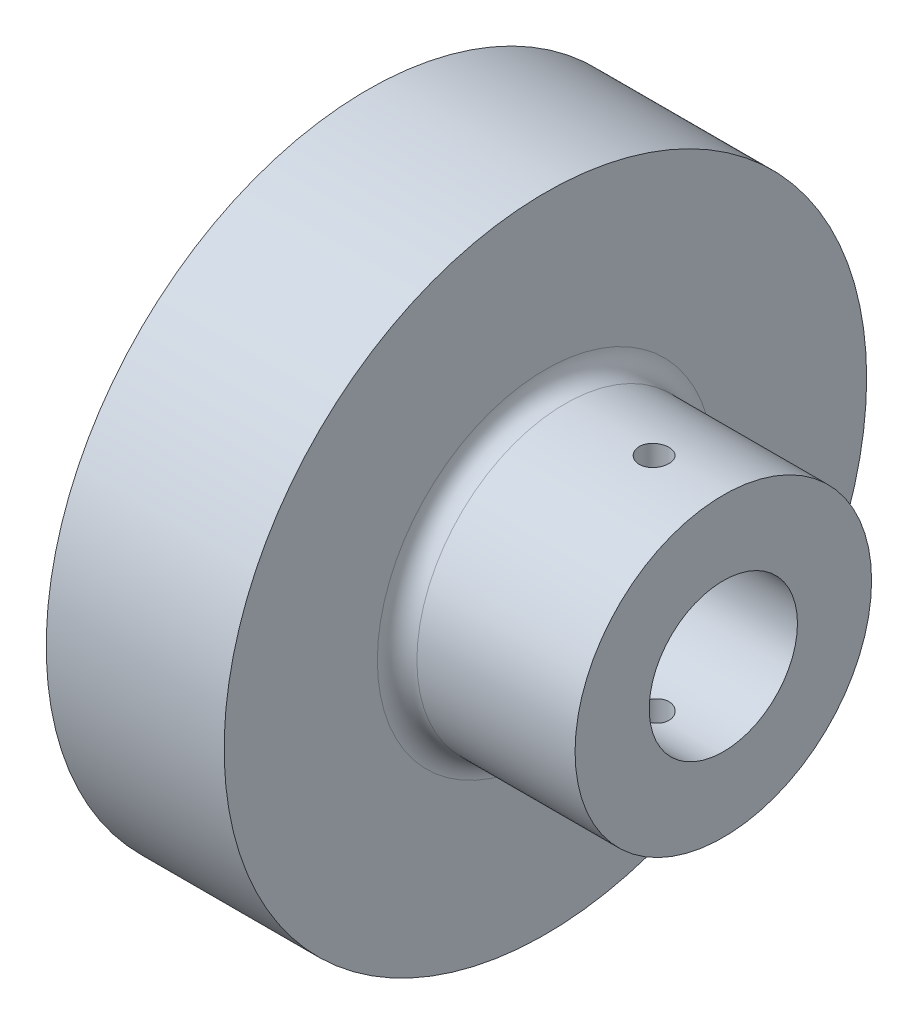
from build123d import *

# Parameters (mm, degrees)
CUT_EXTRUDE1_DEPTH      = 49
CUT_EXTRUDE1_DEPTH_BACK = 47
SKETCH4_R               = 1.5
FILLET1_R               = 2


with BuildPart() as part:
    # Sketch1 → Revolve1 (revolve)
    with BuildSketch(Plane.XY):
        Polygon((38.365950158, 7.5), (10.365950158, 7.5), (10.365950158, 27), (2.365950158, 27), (2.365950158, 32.5), (20.365950158, 32.5), (20.365950158, 15), (38.365950158, 15), align=None)
    revolve(axis=Axis((74.923788079, 0, 0), (-1, 0, 0)))

    # Sketch4 → Cut-Extrude1 (cut, two sides: drawn at the far end of the back side and taken through both)
    with BuildSketch(Plane(origin=(0, 0, 0), x_dir=(1, 0, 0), z_dir=(0, 1, 0)).offset(-CUT_EXTRUDE1_DEPTH_BACK)):
        with Locations((31.365950158, 0)):
            Circle(SKETCH4_R)
    extrude(amount=CUT_EXTRUDE1_DEPTH + CUT_EXTRUDE1_DEPTH_BACK, mode=Mode.SUBTRACT)

    # Fillet1
    fillet1_edges = [part.edges().sort_by_distance(p)[0] for p in [
        (20.365950158, -15, 0),
        (10.365950158, -27, 0),
    ]]
    fillet(fillet1_edges, radius=FILLET1_R)


solid = part.part
